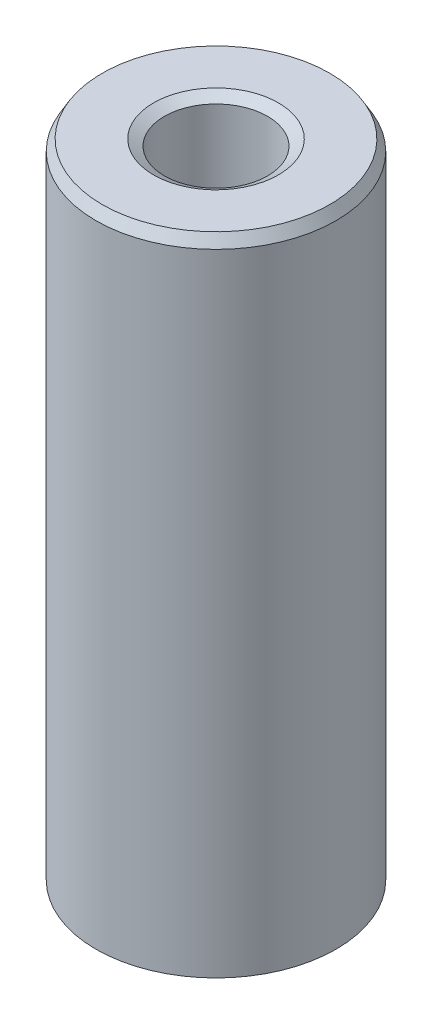
from build123d import *
from OCP.BRepFilletAPI import BRepFilletAPI_MakeChamfer

# Parameters (mm, degrees)
SKETCH1_R           = 35
BOSS_EXTRUDE1_DEPTH = 188.946257243
SKETCH2_R           = 15.048078643
CUT_EXTRUDE1_DEPTH  = 196.322011372
CHAMFER1_SIZE       = 3.158506264
CHAMFER1_SIZE2      = 1.823564442


with BuildPart() as part:
    # Sketch1 → Boss-Extrude1 (new body)
    with BuildSketch(Plane(origin=(0, 0, 0), x_dir=(1, 0, 0), z_dir=(0, 1, 0))):
        Circle(SKETCH1_R)
    extrude(amount=BOSS_EXTRUDE1_DEPTH)

    # Sketch2 → Cut-Extrude1 (cut, through all)
    with BuildSketch(Plane(origin=(0, 0, 0), x_dir=(1, 0, 0), z_dir=(0, 1, 0))):
        Circle(SKETCH2_R)
    extrude(amount=CUT_EXTRUDE1_DEPTH, mode=Mode.SUBTRACT)

    # Chamfer1: one chamfer whose edges measure the first distance from different faces: ONE call of the kernel's chamfer builder (chamfer() names one face for all edges)
    chamfer1_edges_1 = [part.edges().sort_by_distance(p)[0] for p in [
        (-15.048078643, 188.946257243, 0),
    ]]
    chamfer1_side_1 = [part.faces().sort_by_distance(p)[0] for p in [
        (-34.010050506, 188.946257243, 0),
    ]]
    chamfer1_edges_2 = [part.edges().sort_by_distance(p)[0] for p in [
        (-15.048078643, 0, 0),
    ]]
    chamfer1_side_2 = [part.faces().sort_by_distance(p)[0] for p in [
        (-15.048078643, 94.473128622, 0),
    ]]
    chamfer1_edges_3 = [part.edges().sort_by_distance(p)[0] for p in [
        (-35, 0, 0),
    ]]
    chamfer1_side_3 = [part.faces().sort_by_distance(p)[0] for p in [
        (-34.010050506, 0, 0),
    ]]
    chamfer1_edges_4 = [part.edges().sort_by_distance(p)[0] for p in [
        (-35, 188.946257243, 0),
    ]]
    chamfer1_side_4 = [part.faces().sort_by_distance(p)[0] for p in [
        (-35, 94.473128622, 0),
    ]]
    chamfer1 = BRepFilletAPI_MakeChamfer(part.part.solid().wrapped)
    for e in chamfer1_edges_1:
        chamfer1.Add(CHAMFER1_SIZE, CHAMFER1_SIZE2, e.wrapped, chamfer1_side_1[0].wrapped)  # the first distance lies on this face
    for e in chamfer1_edges_2:
        chamfer1.Add(CHAMFER1_SIZE, CHAMFER1_SIZE2, e.wrapped, chamfer1_side_2[0].wrapped)  # the first distance lies on this face
    for e in chamfer1_edges_3:
        chamfer1.Add(CHAMFER1_SIZE, CHAMFER1_SIZE2, e.wrapped, chamfer1_side_3[0].wrapped)  # the first distance lies on this face
    for e in chamfer1_edges_4:
        chamfer1.Add(CHAMFER1_SIZE, CHAMFER1_SIZE2, e.wrapped, chamfer1_side_4[0].wrapped)  # the first distance lies on this face
    add(Compound.cast(chamfer1.Shape()), mode=Mode.REPLACE)


solid = part.part
